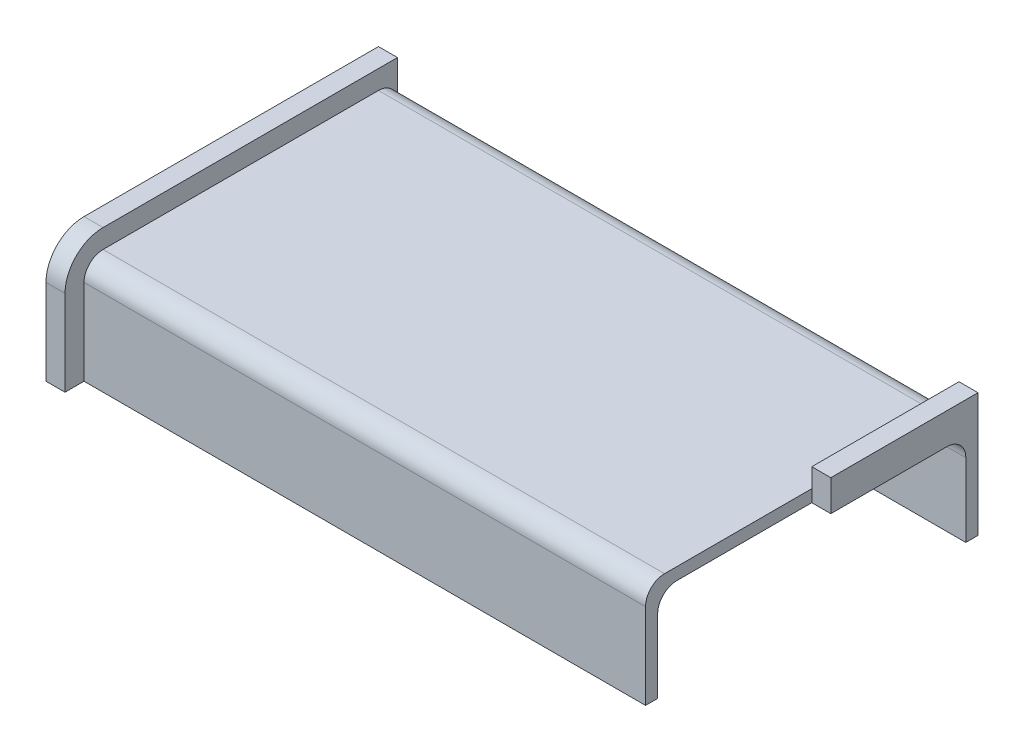
from build123d import *

# Parameters (mm, degrees)
EXTRUDE_THIN1_DEPTH = 46.863
BOSS_EXTRUDE1_START = 3.175
BOSS_EXTRUDE1_DEPTH = 3.175
FILLET1_START       = -50.038
FILLET1_DEPTH       = 100.076
FILLET2_START       = -50.038
FILLET2_DEPTH       = 100.076
SKETCH4_W           = 30.9245
SKETCH4_H           = 20.6375
CUT_EXTRUDE1_DEPTH  = 3.175


with BuildPart() as part:
    # Sketch2 → Extrude-Thin1 (new, symmetric)
    with BuildSketch(Plane(origin=(0, 0, 0), x_dir=(0, 0, -1), z_dir=(1, 0, 0))):
        with BuildLine():
            Line((0, 0), (0, 14.2875))
            ThreePointArc((0, 14.2875), (0.92993597, 16.53256403), (3.175, 17.4625))
            Line((3.175, 17.4625), (49.149, 17.4625))
            ThreePointArc((49.149, 17.4625), (51.39406403, 16.53256403), (52.324, 14.2875))
            Line((52.324, 14.2875), (52.324, 0))
            Line((52.324, 0), (50.292, 0))
            Line((50.292, 0), (50.292, 14.2875))
            ThreePointArc((50.292, 14.2875), (49.957223051, 15.095723051), (49.149, 15.4305))
            Line((49.149, 15.4305), (3.175, 15.4305))
            ThreePointArc((3.175, 15.4305), (2.366776949, 15.095723051), (2.032, 14.2875))
            Line((2.032, 14.2875), (2.032, 0))
            Line((2.032, 0), (0, 0))
        make_face()
    extrude(amount=EXTRUDE_THIN1_DEPTH, both=True)

    # Sketch3 → Boss-Extrude1 (add)
    with BuildSketch(Plane(origin=(46.863, 0, 0), x_dir=(0, 0, -1), z_dir=(1, 0, 0)).offset(BOSS_EXTRUDE1_START)):
        with BuildLine():
            Line((52.324, 20.6375), (3.175, 20.6375))
            ThreePointArc((3.175, 20.6375), (-1.315128061, 18.777628061), (-3.175, 14.2875))
            Line((-3.175, 14.2875), (-3.175, 0))
            Line((-3.175, 0), (0, 0))
            Line((0, 0), (2.032, 0))
            Line((2.032, 0), (2.032, 14.2875))
            ThreePointArc((2.032, 14.2875), (2.366776949, 15.095723051), (3.175, 15.4305))
            Line((3.175, 15.4305), (49.149, 15.4305))
            ThreePointArc((49.149, 15.4305), (49.957223051, 15.095723051), (50.292, 14.2875))
            Line((50.292, 14.2875), (50.292, 0))
            Line((50.292, 0), (52.324, 0))
            Line((52.324, 0), (52.324, 14.2875))
            Line((52.324, 14.2875), (52.324, 20.6375))
        make_face()
    boss_extrude1 = extrude(amount=-BOSS_EXTRUDE1_DEPTH)

    # Mirror1: Boss-Extrude1 across plane
    add(boss_extrude1.mirror(Plane(origin=(0, 0, 0), x_dir=(0, 0, 1), z_dir=(1, 0, 0))))

    # Fillet1: read off the stored shape, not the designer's step
    # Fillet1 outline → Fillet1 (add)
    with BuildSketch(Plane.YZ.offset(FILLET1_START)):
        with BuildLine():
            ThreePointArc((15.4305, -47.117), (14.50056403, -49.36206403), (12.2555, -50.292))
            Line((12.2555, -50.292), (14.2875, -50.292))
            ThreePointArc((14.2875, -50.292), (15.095723051, -49.957223051), (15.4305, -49.149))
            Line((15.4305, -49.149), (15.4305, -47.117))
        make_face()
    extrude(amount=FILLET1_DEPTH)

    # Fillet2: read off the stored shape, not the designer's step
    # Fillet2 outline → Fillet2 (add)
    with BuildSketch(Plane.YZ.offset(FILLET2_START)):
        with BuildLine():
            ThreePointArc((12.2555, -2.032), (14.50056403, -2.96193597), (15.4305, -5.207))
            Line((15.4305, -5.207), (15.4305, -3.175))
            ThreePointArc((15.4305, -3.175), (15.095723051, -2.366776949), (14.2875, -2.032))
            Line((14.2875, -2.032), (12.2555, -2.032))
        make_face()
    extrude(amount=FILLET2_DEPTH)

    # Sketch4 → Cut-Extrude1 (cut)
    with BuildSketch(Plane(origin=(50.038, 0, 0), x_dir=(0, 0, -1), z_dir=(1, 0, 0))):
        with Locations((12.28725, 10.31875)):
            Rectangle(SKETCH4_W, SKETCH4_H)
    extrude(amount=-CUT_EXTRUDE1_DEPTH, mode=Mode.SUBTRACT)


solid = part.part
